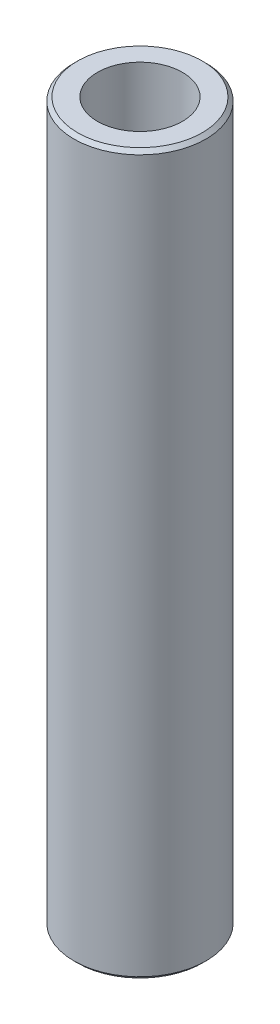
from build123d import *

# Parameters (mm, degrees)
SKETCH1_R           = 55
BOSS_EXTRUDE1_DEPTH = 600
SKETCH2_R           = 35.4763559
CUT_EXTRUDE1_DEPTH  = 606.020660804
CHAMFER1_SIZE       = 3.045195459


with BuildPart() as part:
    # Sketch1 → Boss-Extrude1 (new body)
    with BuildSketch(Plane(origin=(0, 0, 0), x_dir=(1, 0, 0), z_dir=(0, 1, 0))):
        Circle(SKETCH1_R)
    extrude(amount=BOSS_EXTRUDE1_DEPTH)

    # Sketch2 → Cut-Extrude1 (cut, through all)
    with BuildSketch(Plane(origin=(0, 0, 0), x_dir=(1, 0, 0), z_dir=(0, 1, 0))):
        Circle(SKETCH2_R)
    extrude(amount=CUT_EXTRUDE1_DEPTH, mode=Mode.SUBTRACT)

    # Chamfer1
    chamfer1_edges = [part.edges().sort_by_distance(p)[0] for p in [
        (-55, 600, 0),
        (-55, 0, 0),
    ]]
    chamfer(chamfer1_edges, length=CHAMFER1_SIZE)


solid = part.part
